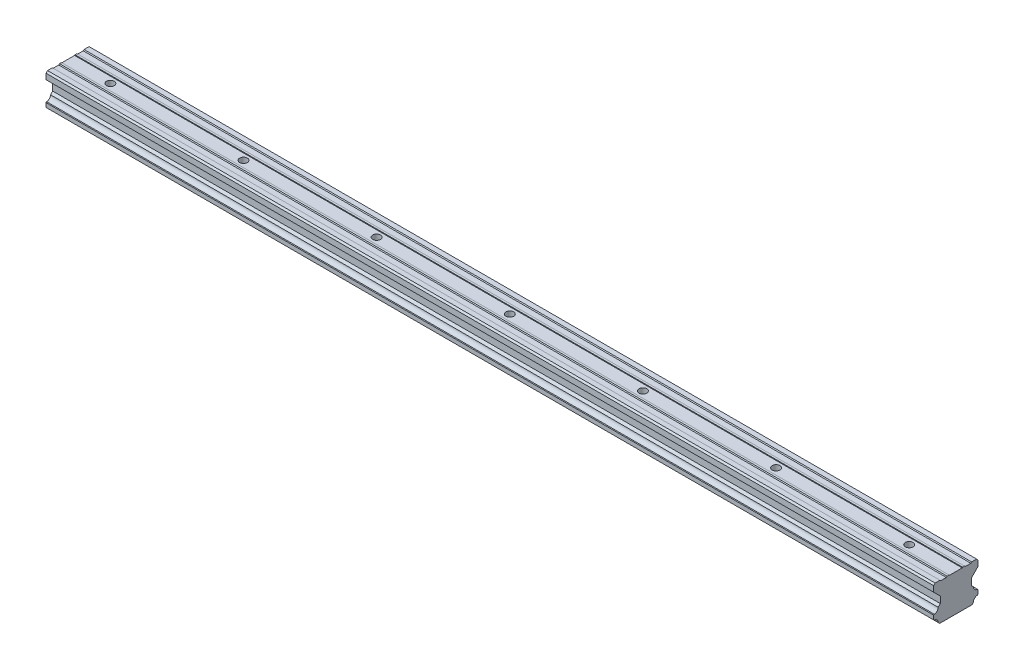
from build123d import *

# Parameters (mm, degrees)
BOSS_EXTRUDE1_DEPTH = 400
HOLE1_D             = 3.5
HOLE1_CBORE_D       = 6
HOLE1_CBORE_DEPTH   = 8.5
LPATTERN1_COUNT     = 7
LPATTERN1_PITCH     = 60


with BuildPart() as part:
    # Sketch1 → Boss-Extrude1 (new body)
    with BuildSketch(Plane(origin=(0, 0, 0), x_dir=(0, 0, -1), z_dir=(1, 0, 0))):
        with BuildLine():
            Line((-7.965754986, -7.693975449), (-7.266272068, -8.393458366))
            Line((-7.266272068, -8.393458366), (7.266272068, -8.393458366))
            Line((7.266272068, -8.393458366), (7.965754986, -7.693975449))
            ThreePointArc((7.965754986, -7.693975449), (8.474723757, -6.421557866), (9.747437917, -5.913331162))
            Line((9.747437917, -5.913331162), (10.000000437, -5.660768637))
            Line((10.000000437, -5.660768637), (10.000000437, -3.788406023))
            Line((10.000000437, -3.788406023), (9.747437912, -3.535843503))
            ThreePointArc((9.747437912, -3.535843503), (8.462742055, -3.016656911), (7.965755402, -1.72321096))
            Line((7.965755402, -1.72321096), (7.005148341, -0.762603918))
            Line((7.005148341, -0.762603918), (7.005148341, 2.166206023))
            Line((7.005148341, 2.166206023), (10.000000347, 5.161058089))
            Line((10.000000347, 5.161058089), (10.000000347, 7.712387211))
            Line((10.000000347, 7.712387211), (9.408464779, 8.393458268))
            Line((9.408464779, 8.393458268), (7.133016457, 8.393458268))
            Line((7.133016457, 8.393458268), (6.789534443, 8.049976247))
            Line((6.789534443, 8.049976247), (4.271139656, 8.049976247))
            Line((4.271139656, 8.049976247), (3.927707784, 8.393458265))
            Line((3.927707784, 8.393458265), (3.061282509, 8.393458265))
            Line((3.061282509, 8.393458265), (2.872049327, 8.204225079))
            Line((2.872049327, 8.204225079), (-2.87204886, 8.204225079))
            Line((-2.87204886, 8.204225079), (-3.061282046, 8.393458261))
            Line((-3.061282046, 8.393458261), (-3.927707321, 8.393458261))
            Line((-3.927707321, 8.393458261), (-4.271189216, 8.049976359))
            Line((-4.271189216, 8.049976359), (-6.789534095, 8.049976359))
            Line((-6.789534095, 8.049976359), (-7.133016116, 8.393458373))
            Line((-7.133016116, 8.393458373), (-9.30771733, 8.393458373))
            Line((-9.30771733, 8.393458373), (-10, 7.70117569))
            Line((-10, 7.70117569), (-10, 5.161058187))
            Line((-10, 5.161058187), (-7.005147934, 2.166206181))
            Line((-7.005147934, 2.166206181), (-7.005147934, -0.76260376))
            Line((-7.005147934, -0.76260376), (-7.965754986, -1.723210812))
            ThreePointArc((-7.965754986, -1.723210812), (-8.462741848, -3.016656549), (-9.747437477, -3.535843372))
            Line((-9.747437477, -3.535843372), (-10, -3.788405895))
            Line((-10, -3.788405895), (-10, -5.660768509))
            Line((-10, -5.660768509), (-9.747437477, -5.913331032))
            ThreePointArc((-9.747437477, -5.913331032), (-8.474723558, -6.421557943), (-7.965754986, -7.693975449))
        make_face()
    extrude(amount=BOSS_EXTRUDE1_DEPTH)

    # Hole1 (through all)
    with Locations(Plane(origin=(19, -8.393458366, 0), x_dir=(0, 0, -1), z_dir=(0, -1, 0))):
        with Locations((0, 0)):
            hole1 = CounterBoreHole(HOLE1_D / 2, HOLE1_CBORE_D / 2, HOLE1_CBORE_DEPTH)

    # LPattern1: Hole1 ×7
    with Locations(*[(i * LPATTERN1_PITCH, 0, 0) for i in range(1, LPATTERN1_COUNT)]):
        add(hole1, mode=Mode.SUBTRACT)


solid = part.part
